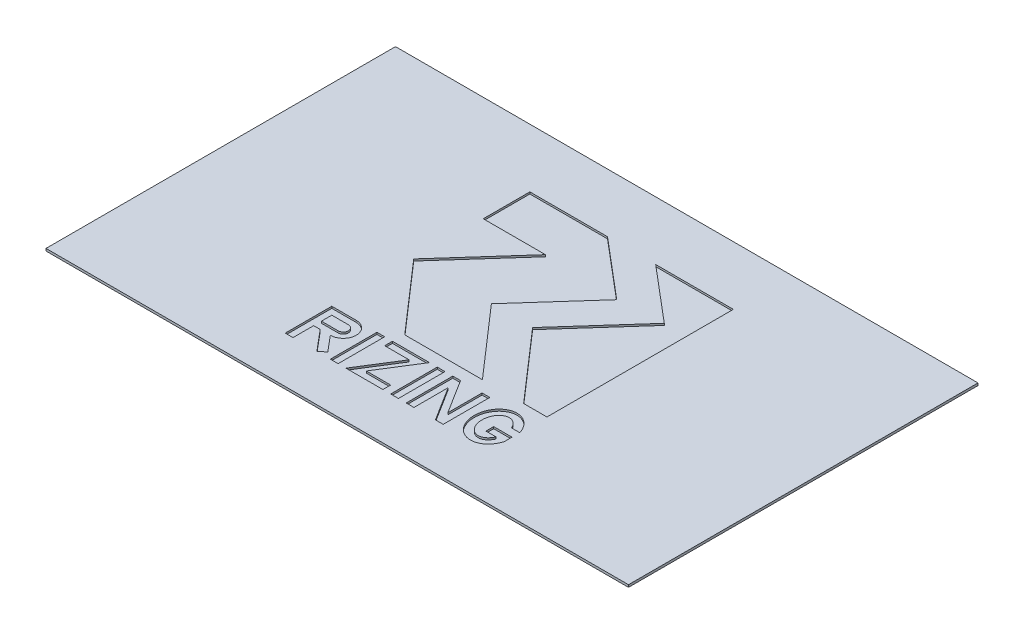
from build123d import *

# Parameters (mm, degrees)
SKETCH_7_W       = 25
SKETCH_7_H       = 15
EXTRUDE_3_DEPTH  = 0.1
WRAP_START       = -0.08
WRAP_4_OUTLINE_W = 0.333333333
WRAP_4_OUTLINE_H = 2
WRAP_4_DEPTH     = 0.08


# Read off the part's stored shape, not the designer's step: 包覆4
with BuildPart() as part:
    # 草图7 → 凸台-拉伸3 (new body)
    with BuildSketch(Plane(origin=(0, 0, 0), x_dir=(1, 0, 0), z_dir=(0, 1, 0))):
        Rectangle(SKETCH_7_W, SKETCH_7_H)
    extrude(amount=EXTRUDE_3_DEPTH)

    # 包覆4 outline → 包覆4 (cut)
    # profile 1 of 8: a face of its own
    with BuildSketch(Plane(origin=(0, 0.1, 0), x_dir=(1, 0, 0), z_dir=(0, 1, 0)).offset(WRAP_START)):
        with BuildLine():
            Line((3.729916803, -4.849124174), (4.162929505, -4.849124174))
            add(Edge.make_bspline(
                [(4.162929505, -4.849124174), (3.229916803, -7.003824712), (3.229916803, -4.51579084), (3.229916803, -2.027756968), (4.162929505, -4.182457507)],
                knots=[5.235987756, 5.235987756, 5.235987756, 7.853981634, 7.853981634, 10.471975512, 10.471975512, 10.471975512], degree=2, weights=[1, 0.258819045, 1, 0.258819045, 1]))
            Line((4.162929505, -4.182457507), (4.515591004, -4.182457507))
            add(Edge.make_bspline(
                [(4.515591004, -4.182457507), (4.140064403, -2.907877957), (3.234343313, -3.711834399), (2.328622224, -4.51579084), (3.234343313, -5.319747282), (4.140064403, -6.123703723), (4.515591004, -4.849124174)],
                knots=[1.910633236, 1.910633236, 1.910633236, 3.778470399, 3.778470399, 5.646307562, 5.646307562, 7.514144725, 7.514144725, 7.514144725], degree=2, weights=[1, 0.594688187, 1, 0.594688187, 1, 0.594688187, 1]))
            Line((4.515591004, -4.849124174), (4.515591004, -4.51579084))
            Line((4.515591004, -4.51579084), (3.729916803, -4.51579084))
            Line((3.729916803, -4.51579084), (3.729916803, -4.849124174))
        make_face()
    # profile 2 of 8: a face of its own
    with BuildSketch(Plane(origin=(0, 0.1, 0), x_dir=(1, 0, 0), z_dir=(0, 1, 0)).offset(WRAP_START)):
        Polygon((-4.218026957, 4.98420916), (-4.218026957, 2.98420916), (-1.55136029, 2.98420916), (-4.218026957, 0), (-1.587129576, -3.01579084), (1.746203758, -3.01579084), (-0.884693623, 0), (1.654021847, 2.841021735), (-0.884693623, 4.98420916), align=None)
    # profile 3 of 8: a face of its own
    with BuildSketch(Plane(origin=(0, 0.1, 0), x_dir=(1, 0, 0), z_dir=(0, 1, 0)).offset(WRAP_START)):
        Polygon((0.884693623, 0), (3.515591004, -3.01579084), (4.515591004, -3.01579084), (4.515591004, 4.98420916), (1.182257671, 4.98420916), (3.55136029, 2.98420916), align=None)
    # profile 4 of 8: a face of its own
    with BuildSketch(Plane(origin=(0, 0.1, 0), x_dir=(1, 0, 0), z_dir=(0, 1, 0)).offset(WRAP_START)):
        with BuildLine():
            Line((-3.169857983, -3.51579084), (-4.218026957, -3.51579084))
            Line((-4.218026957, -3.51579084), (-4.218026957, -5.51579084))
            Line((-4.218026957, -5.51579084), (-3.884693623, -5.51579084))
            Line((-3.884693623, -5.51579084), (-3.884693623, -4.626901951))
            Line((-3.884693623, -4.626901951), (-3.604993746, -4.626901951))
            Line((-3.604993746, -4.626901951), (-2.859127408, -5.51579084))
            Line((-2.859127408, -5.51579084), (-2.60377926, -5.301528304))
            Line((-2.60377926, -5.301528304), (-3.169857983, -4.626901951))
            ThreePointArc((-3.169857983, -4.626901951), (-2.614302428, -4.071346395), (-3.169857983, -3.51579084))
        make_face()
        with BuildLine():
            Line((-3.884693623, -4.293568618), (-3.884693623, -3.849124174))
            Line((-3.884693623, -3.849124174), (-3.169857983, -3.849124174))
            ThreePointArc((-3.169857983, -3.849124174), (-2.947635761, -4.071346396), (-3.169857983, -4.293568618))
            Line((-3.169857983, -4.293568618), (-3.884693623, -4.293568618))
        make_face(mode=Mode.SUBTRACT)
    # profile 5 of 8: a face of its own
    with BuildSketch(Plane(origin=(0, 0.1, 0), x_dir=(1, 0, 0), z_dir=(0, 1, 0)).offset(WRAP_START)):
        with Locations((-2.114302428, -4.51579084)):
            Rectangle(WRAP_4_OUTLINE_W, WRAP_4_OUTLINE_H)
    # profile 6 of 8: a face of its own
    with BuildSketch(Plane(origin=(0, 0.1, 0), x_dir=(1, 0, 0), z_dir=(0, 1, 0)).offset(WRAP_START)):
        Polygon((-1.071728603, -5.182457507), (-0.025526146, -3.51579084), (-1.614302428, -3.51579084), (-1.614302428, -3.849124174), (-0.56809997, -3.849124174), (-1.614302428, -5.51579084), (-0.025526146, -5.51579084), (-0.025526146, -5.182457507), align=None)
    # profile 7 of 8: a face of its own
    with BuildSketch(Plane(origin=(0, 0.1, 0), x_dir=(1, 0, 0), z_dir=(0, 1, 0)).offset(WRAP_START)):
        with Locations((0.474473855, -4.51579084)):
            Rectangle(WRAP_4_OUTLINE_W, WRAP_4_OUTLINE_H)
    # profile 8 of 8: a face of its own
    with BuildSketch(Plane(origin=(0, 0.1, 0), x_dir=(1, 0, 0), z_dir=(0, 1, 0)).offset(WRAP_START)):
        Polygon((2.563250136, -5.51579084), (2.563250136, -3.51579084), (2.229916803, -3.51579084), (2.229916803, -4.984769763), (1.307807188, -3.51579084), (0.974473854, -3.51579084), (0.974473854, -5.51579084), (1.307807188, -5.51579084), (1.307807188, -4.046811917), (2.229916803, -5.51579084), align=None)
    extrude(amount=WRAP_4_DEPTH, mode=Mode.SUBTRACT)


solid = part.part
